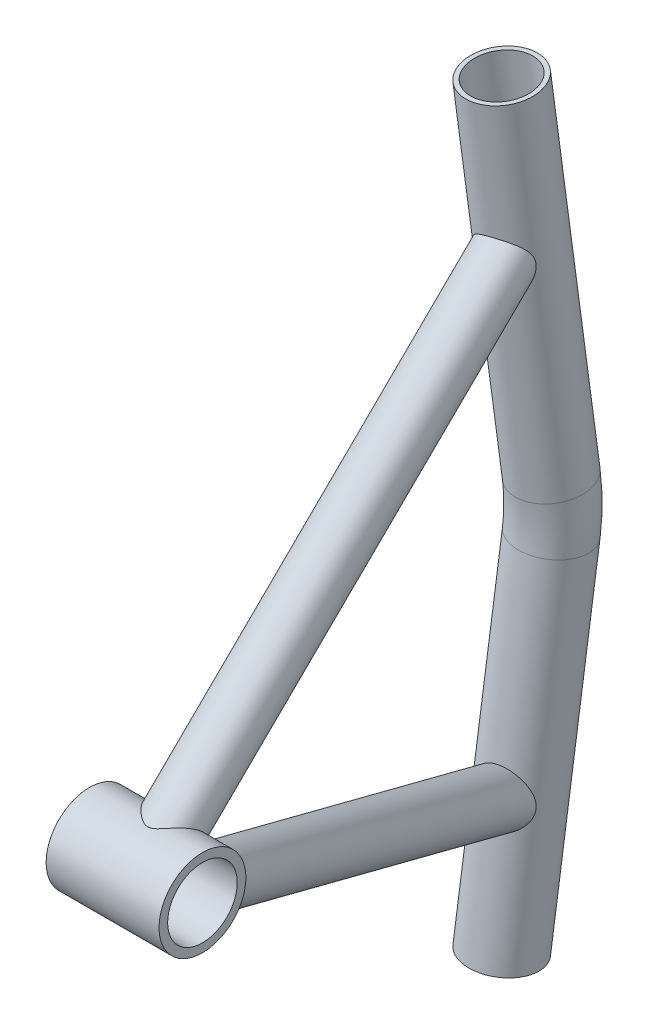
from build123d import *

# Parameters (mm, degrees)
SKETCH6_W                = 41.275
SKETCH6_H                = 3.1496
BOSS_EXTRUDE1_REACH      = 236.173
BOSS_EXTRUDE1_END_RADIUS = 15.875
SKETCH10_R               = 9.525
SKETCH10_R_2             = 7.874
BOSS_EXTRUDE2_REACH      = 282.766
BOSS_EXTRUDE2_END_RADIUS = 15.875
SKETCH11_R               = 9.525
SKETCH11_R_2             = 7.874
SKETCH12_R               = 12.7
SKETCH15_R               = 12.7
SKETCH15_R_2             = 11.049


with BuildPart() as part:
    # Sketch6 → Revolve2 (revolve)
    with BuildSketch(Plane(origin=(0, 0, 0), x_dir=(1, 0, 0), z_dir=(0, 1, 0))):
        with Locations((0, 14.3002)):
            Rectangle(SKETCH6_W, SKETCH6_H)
    revolve(axis=Axis((-66.78681796, 0, 0), (1, 0, 0)))


with BuildPart() as body_2:
    # Boss-Extrude1: up to this cylinder (the profile starts outside it)
    boss_extrude1_end = Plane(origin=(-36.684174, 0, 0), z_dir=(-1, 0, 0)) * Cylinder(BOSS_EXTRUDE1_END_RADIUS, 505.096, mode=Mode.PRIVATE)
    # Sketch10 → Boss-Extrude1 (new, up to the surface)
    with BuildSketch(Plane(origin=(-45.678868166, 89.236316096, -182.596530613), x_dir=(-0.9718118422845564, -0.09767658435659733, 0.21457173174471317), z_dir=(-0.23575780622388015, 0.40263040665345673, -0.8844812109042088)), mode=Mode.PRIVATE) as boss_extrude1_sk1:
        Circle(SKETCH10_R)
        Circle(SKETCH10_R_2, mode=Mode.SUBTRACT)
    boss_extrude1_tool1 = extrude(boss_extrude1_sk1.sketch, amount=-BOSS_EXTRUDE1_REACH, mode=Mode.PRIVATE) - boss_extrude1_end
    add(boss_extrude1_tool1.solids().sort_by_distance((-36.684174, 90.140371, -184.582519))[0])


with BuildPart() as body_3:
    # Boss-Extrude2: up to this cylinder (the profile starts outside it)
    boss_extrude2_end = Plane(origin=(-36.684174, 0, 0), z_dir=(-1, 0, 0)) * Cylinder(BOSS_EXTRUDE2_END_RADIUS, 598.282, mode=Mode.PRIVATE)
    # Sketch11 → Boss-Extrude2 (new, up to the surface)
    with BuildSketch(Plane(origin=(-45.678868166, -89.236316096, -182.596530613), x_dir=(-0.9718118422845564, 0.09767658435659739, 0.21457173174471303), z_dir=(-0.23575780622388007, -0.40263040665345723, -0.8844812109042086)), mode=Mode.PRIVATE) as boss_extrude2_sk1:
        Circle(SKETCH11_R)
        Circle(SKETCH11_R_2, mode=Mode.SUBTRACT)
    boss_extrude2_tool1 = extrude(boss_extrude2_sk1.sketch, amount=-BOSS_EXTRUDE2_REACH, mode=Mode.PRIVATE) - boss_extrude2_end
    add(boss_extrude2_tool1.solids().sort_by_distance((-36.684174, -90.140371, -184.582519))[0])


with BuildPart() as cut_sweep1_tool:
    # Cut-Sweep1: sweep along a curve in space
    with BuildLine() as cut_sweep1_path:
        Line((-47.937055144, 138.471469808, -177.943551359), (-42.011992023, 9.287572997, -190.152104526))
        ThreePointArc((-42.011992023, 9.287572997, -190.152104526), (-41.79958754, 0, -190.589762549), (-42.011992023, -9.287572997, -190.152104526))
        Line((-42.011992023, -9.287572997, -190.152104526), (-47.937055144, -138.471469808, -177.943551359))
    # Sketch12 → Cut-Sweep1 (sweep)
    with BuildSketch(Plane(origin=(-47.937055144, -138.471469808, -177.943551359), x_dir=(-0.9989591236170096, 0.045412012617268314, -0.004291672446182792), z_dir=(-0.045614354564503724, -0.9945278138635109, 0.09398807429418847))):
        Circle(SKETCH12_R)
    sweep(path=cut_sweep1_path.line)


with BuildPart() as body_2_1:
    add(body_2.part)

    # Cut-Sweep1: cut by cut_sweep1_tool
    add(cut_sweep1_tool.part, mode=Mode.SUBTRACT)


with BuildPart() as body_3_1:
    add(body_3.part)

    # Cut-Sweep1: cut by cut_sweep1_tool
    add(cut_sweep1_tool.part, mode=Mode.SUBTRACT)


with BuildPart() as body_4:
    # Sweep2: sweep along a path in Sketch14
    with BuildLine(Plane(origin=(-108.695110163, 0, -52.751982968), x_dir=(0.43661741575798063, 0, -0.8996472821371844), z_dir=(0.8996472821371844, 0, 0.43661741575798063))) as sweep2_path:
        Line((139.156279218, 138.471469808), (152.726656641, 9.287572997))
        ThreePointArc((152.726656641, 9.287572997), (153.213133989, 0), (152.726656641, -9.287572997))
        Line((152.726656641, -9.287572997), (139.156279218, -138.471469808))
    # Sketch15 → Sweep2 (sweep)
    with BuildSketch(Plane(origin=(-47.937055144, -138.471469808, -177.943551359), x_dir=(-0.9989591236170096, 0.045412012617268314, -0.004291672446182792), z_dir=(-0.045614354564503724, -0.9945278138635109, 0.09398807429418847))):
        Circle(SKETCH15_R)
        Circle(SKETCH15_R_2, mode=Mode.SUBTRACT)
    sweep(path=sweep2_path.line)


solid = Compound([part.part, body_2_1.part, body_3_1.part, body_4.part])
